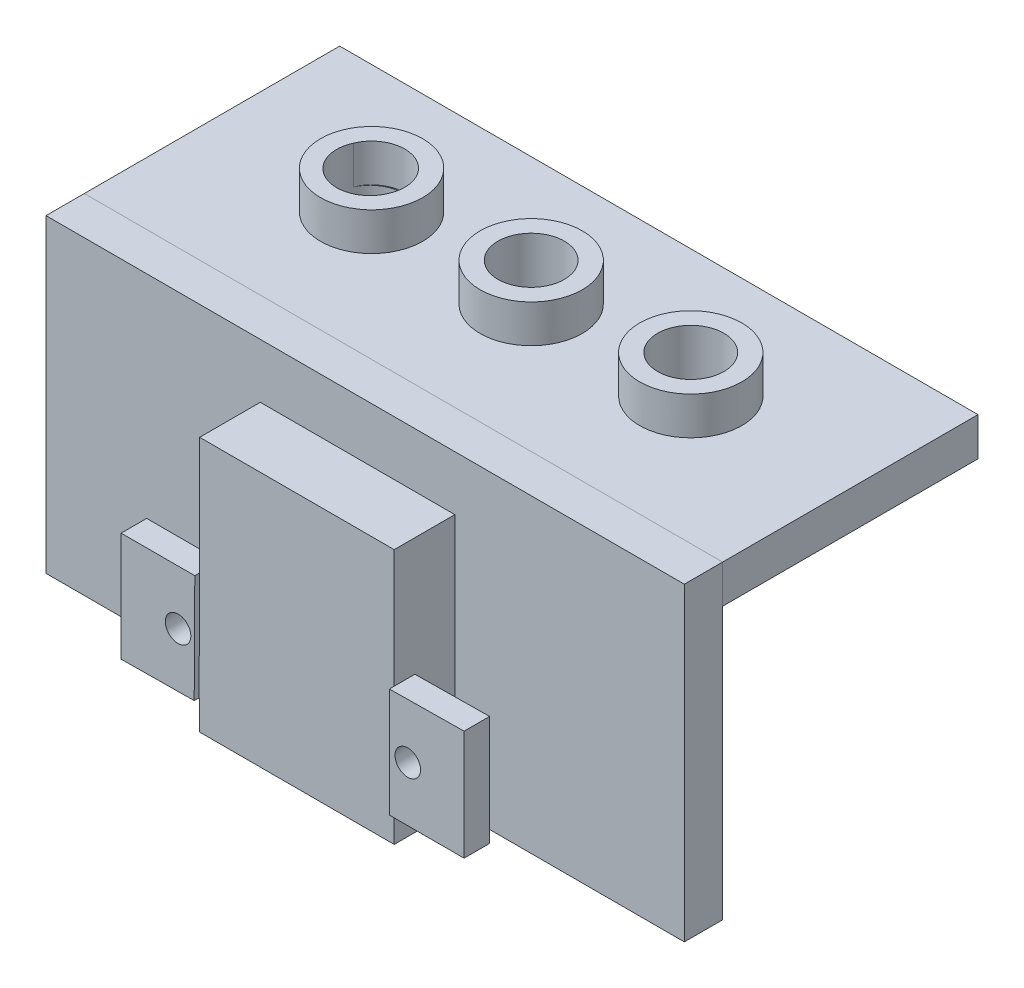
from build123d import *

# Parameters (mm, degrees)
SKETCH1_W               = 50
SKETCH1_H               = 20
BOSS_EXTRUDE2_DEPTH     = 3
SKETCH3_R               = 4
BOSS_EXTRUDE3_DEPTH     = 6.27
CUT_EXTRUDE1_DEPTH      = 29.476883608
CUT_EXTRUDE1_DEPTH_BACK = 29.476883608
SKETCH4_R               = 2.6
SKETCH5_W               = 20
SKETCH5_H               = 2.3
BOSS_EXTRUDE4_DEPTH     = 50
CUT_EXTRUDE2_DEPTH      = 52.825986725
CUT_EXTRUDE2_DEPTH_BACK = 52.825986725
SKETCH6_W               = 20
SKETCH6_H               = 2.65
CUT_EXTRUDE3_DEPTH      = 28.727682918
CUT_EXTRUDE3_DEPTH_BACK = 28.727682918
SKETCH7_R               = 2.6
BOSS_EXTRUDE5_DEPTH     = 50
CUT_EXTRUDE4_DEPTH      = 28.173621503
CUT_EXTRUDE4_DEPTH_BACK = 28.173621503
SKETCH10_R              = 2.6
CUT_EXTRUDE5_DEPTH      = 52.826789459
CUT_EXTRUDE5_DEPTH_BACK = 52.826789459
BOSS_EXTRUDE6_DEPTH     = 50
BOSS_EXTRUDE9_DEPTH     = 4.75
BOSS_EXTRUDE10_DEPTH    = 0.38
CUT_EXTRUDE6_DEPTH      = 42.706449468
CUT_EXTRUDE6_DEPTH_BACK = 42.706449468
SKETCH20_R              = 0.99991683
CUT_EXTRUDE7_DEPTH      = 40.726538508
CUT_EXTRUDE7_DEPTH_BACK = 40.726538508
SKETCH21_W              = 5.768937412
SKETCH21_H              = 3.13
SKETCH21_W_2            = 5.85423369


with BuildPart() as part:
    # Sketch1 → Boss-Extrude2 (new body)
    with BuildSketch(Plane(origin=(0, 0, 0), x_dir=(1, 0, 0), z_dir=(0, 1, 0))):
        Rectangle(SKETCH1_W, SKETCH1_H)
    extrude(amount=BOSS_EXTRUDE2_DEPTH)

    # Sketch3 → Boss-Extrude3 (add)
    with BuildSketch(Plane(origin=(0, 3, 0), x_dir=(1, 0, 0), z_dir=(0, 1, 0))):
        Circle(SKETCH3_R)
        with Locations((-12.5, 0)):
            Circle(SKETCH3_R)
        with Locations((12.5, 0)):
            Circle(SKETCH3_R)
    extrude(amount=BOSS_EXTRUDE3_DEPTH)

    # Sketch4 → Cut-Extrude1 (cut, two sides: drawn at the far end of the back side and taken through both)
    with BuildSketch(Plane(origin=(0, 9.27, 0), x_dir=(1, 0, 0), z_dir=(0, 1, 0)).offset(-CUT_EXTRUDE1_DEPTH_BACK)):
        Circle(SKETCH4_R)
        with Locations((-12.5, 0)):
            Circle(SKETCH4_R)
        with Locations((12.5, 0)):
            Circle(SKETCH4_R)
    extrude(amount=CUT_EXTRUDE1_DEPTH + CUT_EXTRUDE1_DEPTH_BACK, mode=Mode.SUBTRACT)

    # Sketch5 → Boss-Extrude4 (add)
    with BuildSketch(Plane.ZY.offset(25)):
        with Locations((0, 4.15)):
            Rectangle(SKETCH5_W, SKETCH5_H)
    extrude(amount=-BOSS_EXTRUDE4_DEPTH)

    # Sketch6 → Cut-Extrude2 (cut, two sides: drawn at the far end of the back side and taken through both)
    with BuildSketch(Plane.ZY.offset(25).offset(-CUT_EXTRUDE2_DEPTH_BACK)):
        with Locations((0, 1.325)):
            Rectangle(SKETCH6_W, SKETCH6_H)
    extrude(amount=CUT_EXTRUDE2_DEPTH + CUT_EXTRUDE2_DEPTH_BACK, mode=Mode.SUBTRACT)

    # Sketch7 → Cut-Extrude3 (cut, two sides: drawn at the far end of the back side and taken through both)
    with BuildSketch(Plane.XZ.offset(-2.65).offset(-CUT_EXTRUDE3_DEPTH_BACK)):
        with Locations((-12.5, 0)):
            Circle(SKETCH7_R)
        Circle(SKETCH7_R)
        with Locations((12.5, 0)):
            Circle(SKETCH7_R)
    extrude(amount=CUT_EXTRUDE3_DEPTH + CUT_EXTRUDE3_DEPTH_BACK, mode=Mode.SUBTRACT)

    # Sketch8 → Boss-Extrude5 (add)
    with BuildSketch(Plane.ZY.offset(25)):
        Polygon((-10, 2.65), (10, 2.65), (10.004159415, 6.3), (-10, 6.3), align=None)
    extrude(amount=-BOSS_EXTRUDE5_DEPTH)

    # Sketch10 → Cut-Extrude4 (cut, two sides: drawn at the far end of the back side and taken through both)
    with BuildSketch(Plane(origin=(0, 6.3, 0), x_dir=(1, 0, 0), z_dir=(0, 1, 0)).offset(-CUT_EXTRUDE4_DEPTH_BACK)):
        with Locations((12.5, 0)):
            Circle(SKETCH10_R)
        Circle(SKETCH10_R)
        with Locations((-12.542506815, -0.096829386)):
            Circle(SKETCH10_R)
    extrude(amount=CUT_EXTRUDE4_DEPTH + CUT_EXTRUDE4_DEPTH_BACK, mode=Mode.SUBTRACT)

    # Sketch11 → Cut-Extrude5 (cut, two sides: drawn at the far end of the back side and taken through both)
    with BuildSketch(Plane.ZY.offset(25).offset(-CUT_EXTRUDE5_DEPTH_BACK)):
        Polygon((10, 2.65), (10.000740717, 3.299999578), (-10, 3.299999578), (-10, 2.65), align=None)
    extrude(amount=CUT_EXTRUDE5_DEPTH + CUT_EXTRUDE5_DEPTH_BACK, mode=Mode.SUBTRACT)


with BuildPart() as body_2:
    # Sketch12 → Boss-Extrude6 (new body)
    with BuildSketch(Plane.ZY.offset(25)):
        Polygon((10.004159415, 6.3), (13.004159415, 6.3), (13.004159415, -17.969335025), (10.000740717, -17.969335025), align=None)
    extrude(amount=-BOSS_EXTRUDE6_DEPTH)

    # Sketch13 → Boss-Extrude9 (add)
    with BuildSketch(Plane.XY.offset(13.004159415)):
        Polygon((7.024474415, 2.030664975), (-8.214639806, 2.030664975), (-8.214639806, -7.166617832), (-13.983577218, -7.166617832), (-13.983577218, -15.716999101), (-8.214639806, -15.716999101), (-8.214639806, -17.969335025), (7.024474415, -17.969335025), (7.024474415, -15.784825297), (12.878708105, -15.784825297), (12.878708105, -7.166617832), (7.024474415, -7.234298034), (7.024474415, -4.23472012), align=None)
    extrude(amount=BOSS_EXTRUDE9_DEPTH)

    # Sketch19 → Boss-Extrude10 (add)
    with BuildSketch(Plane.XY.offset(17.754159415)):
        Polygon((-8.214639806, -7.166617832), (-13.983577218, -7.166617832), (-13.983577218, -15.716999101), (-8.261440239, -15.6647406), align=None)
        Polygon((7.024474415, -7.234298034), (7.024474415, -15.784825297), (12.878708105, -15.784825297), (12.878708105, -7.166617832), align=None)
    extrude(amount=BOSS_EXTRUDE10_DEPTH)

    # Sketch20 → Cut-Extrude6 (cut, two sides: drawn at the far end of the back side and taken through both)
    with BuildSketch(Plane.XY.offset(18.134159415).offset(-CUT_EXTRUDE6_DEPTH_BACK)):
        with Locations((-9.525349087, -11.422234965)):
            Circle(SKETCH20_R)
        with Locations((8.46915892, -11.5036264)):
            Circle(SKETCH20_R)
    extrude(amount=CUT_EXTRUDE6_DEPTH + CUT_EXTRUDE6_DEPTH_BACK, mode=Mode.SUBTRACT)

    # Sketch21 → Cut-Extrude7 (cut, two sides: drawn at the far end of the back side and taken through both)
    with BuildSketch(Plane.XZ.offset(15.716999101).offset(-CUT_EXTRUDE7_DEPTH_BACK)):
        with Locations((-11.099108512, 14.569159415)):
            Rectangle(SKETCH21_W, SKETCH21_H)
        with Locations((9.95159126, 14.569159415)):
            Rectangle(SKETCH21_W_2, SKETCH21_H)
    extrude(amount=CUT_EXTRUDE7_DEPTH + CUT_EXTRUDE7_DEPTH_BACK, mode=Mode.SUBTRACT)


solid = Compound([part.part, body_2.part])
